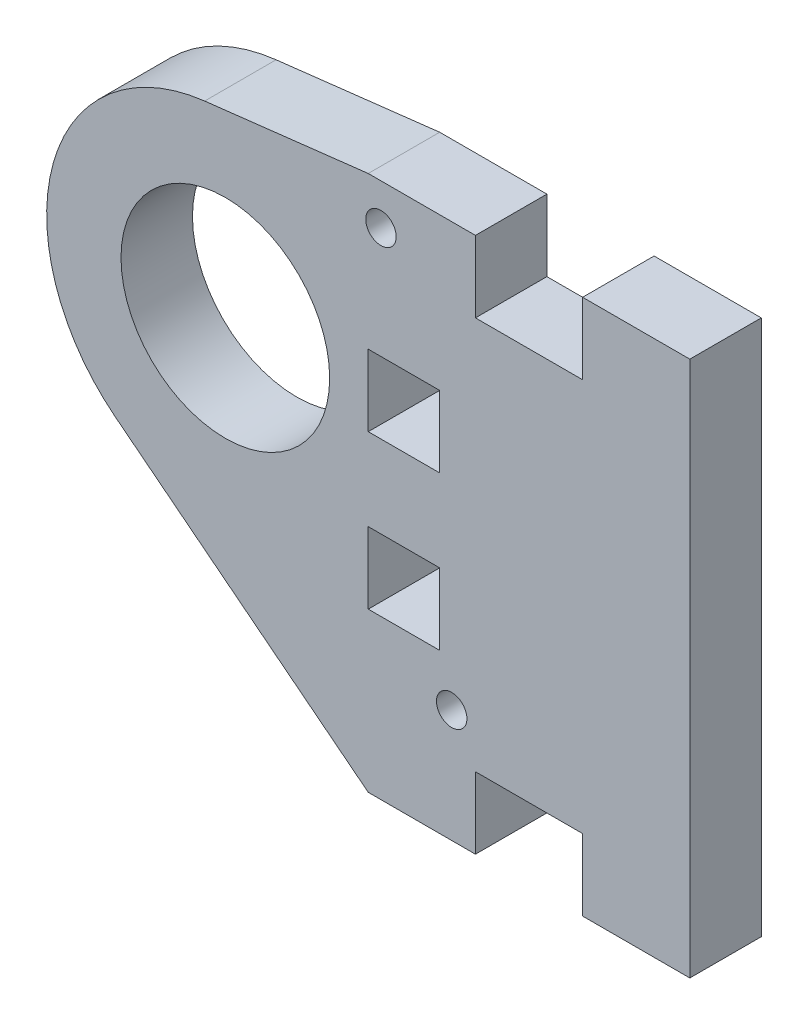
from build123d import *

# Parameters (mm, degrees)
MASS_DEPTH                = 6.35
SKETCH4_R                 = 9.271
CUT_EXTRUDE1_DEPTH        = 45.627810093
SKETCH3_W                 = 9.525
SKETCH3_H                 = 12.7
CUT_EXTRUDE2_DEPTH        = 45.627810093
F_6_32_TAPPED_HOLE1_D     = 2.7051
F_6_32_TAPPED_HOLE1_DEPTH = 152.4
F_6_32_TAPPED_HOLE1_TIP   = 0.81269403
CAVITY1_START             = -2.994165629
CAVITY1_OUTLINE_W         = 6.35
CAVITY1_OUTLINE_H         = 6.35
CAVITY1_DEPTH             = 6.35
CAVITY1_START_2           = 10.66280621
CAVITY1_2_OUTLINE_W       = 6.35
CAVITY1_2_OUTLINE_H       = 6.35
CAVITY1_2_DEPTH           = 6.35


# Read off the part's stored shape, not the designer's step: Cavity1
with BuildPart() as part:
    # Sketch1 → Mass (new body)
    with BuildSketch(Plane.XY):
        with BuildLine():
            Line((3.348333413, -17.092726624), (31.923333413, -17.092726624))
            Line((31.923333413, -17.092726624), (31.923333413, 30.532273376))
            Line((31.923333413, 30.532273376), (3.348333413, 30.532273376))
            Line((3.348333413, 30.532273376), (-11.189304159, 28.838055246))
            ThreePointArc((-11.189304159, 28.838055246), (-24.630570771, 17.379148263), (-19.157836039, 0.585596764))
            Line((-19.157836039, 0.585596764), (3.348333413, -17.092726624))
        make_face()
    extrude(amount=MASS_DEPTH)

    # Sketch4 → Cut-Extrude1 (cut, through all)
    with BuildSketch(Plane(origin=(0, 0, 0), x_dir=(-1, 0, 0), z_dir=(0, 0, -1))):
        with Locations((9.351666587, 13.069773376)):
            Circle(SKETCH4_R)
    extrude(amount=-CUT_EXTRUDE1_DEPTH, mode=Mode.SUBTRACT)

    # Sketch3 → Cut-Extrude2 (cut, through all)
    with BuildSketch(Plane(origin=(0, 0, 0), x_dir=(-1, 0, 0), z_dir=(0, 0, -1))):
        with Locations((-17.635833413, 30.532273376)):
            Rectangle(SKETCH3_W, SKETCH3_H)
        with Locations((-17.635833413, -17.092726624)):
            Rectangle(SKETCH3_W, SKETCH3_H)
    extrude(amount=-CUT_EXTRUDE2_DEPTH, mode=Mode.SUBTRACT)

    # #6-32 Tapped Hole1
    with Locations(Plane.XY.offset(6.35)):
        with Locations((10.764107125, -7.046000335), (4.47792784, 26.899367802), (-9.351666587, 13.069773376)):
            Hole(F_6_32_TAPPED_HOLE1_D / 2, depth=F_6_32_TAPPED_HOLE1_DEPTH)
            with Locations((0, 0, -(F_6_32_TAPPED_HOLE1_DEPTH + F_6_32_TAPPED_HOLE1_TIP / 2))):  # 118° drill point
                Cone(0, F_6_32_TAPPED_HOLE1_D / 2, F_6_32_TAPPED_HOLE1_TIP, mode=Mode.SUBTRACT)

    # Cavity1 outline → Cavity1 (cut)
    with BuildSketch(Plane(origin=(0, 0, 0), x_dir=(1, 0, 0), z_dir=(0, 1, 0)).offset(CAVITY1_START)):
        with Locations((6.523333416, -3.175)):
            Rectangle(CAVITY1_OUTLINE_W, CAVITY1_OUTLINE_H)
    extrude(amount=CAVITY1_DEPTH, mode=Mode.SUBTRACT)

    # Cavity1 2 outline → Cavity1 2 (cut)
    with BuildSketch(Plane(origin=(0, 0, 0), x_dir=(1, 0, 0), z_dir=(0, 1, 0)).offset(CAVITY1_START_2)):
        with Locations((6.523333416, -3.175)):
            Rectangle(CAVITY1_2_OUTLINE_W, CAVITY1_2_OUTLINE_H)
    extrude(amount=CAVITY1_2_DEPTH, mode=Mode.SUBTRACT)


solid = part.part
